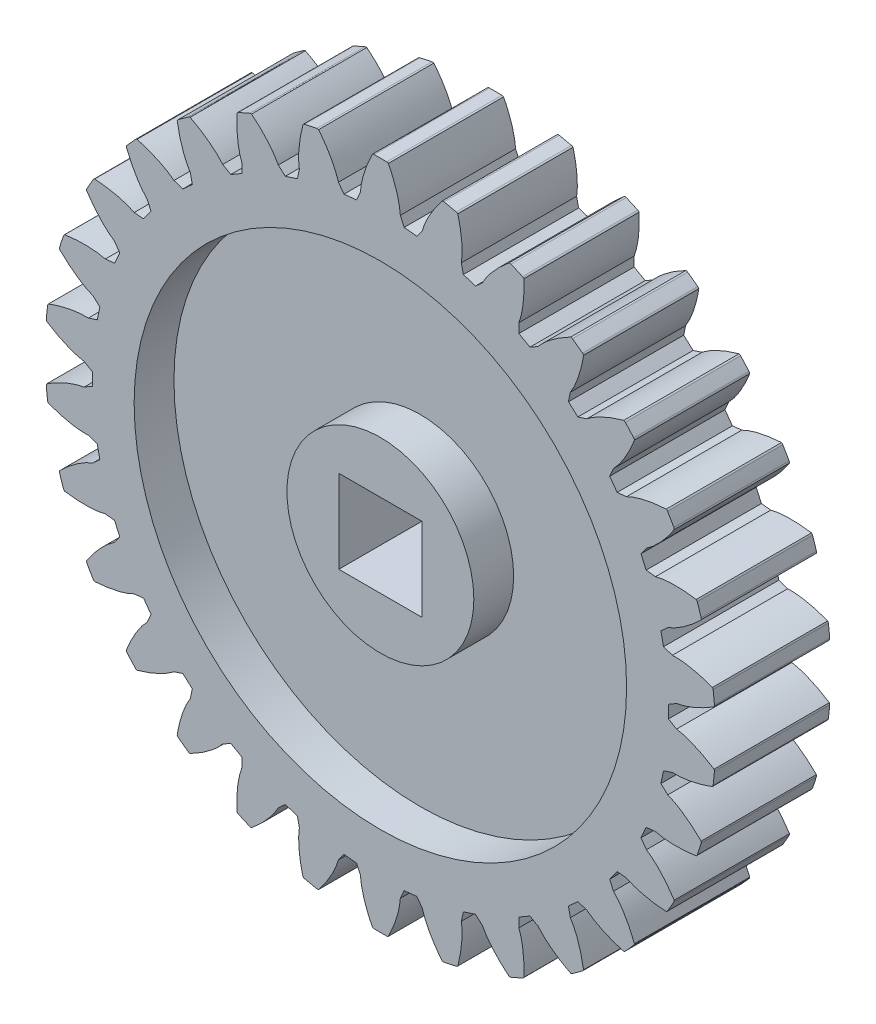
from build123d import *

# Parameters (mm, degrees)
BOSS_EXTRUDE1_DEPTH = 2.75
SKETCH2_R           = 11.75
SKETCH2_R_2         = 4.46
CUT_EXTRUDE1_DEPTH  = 1.9
CUT_EXTRUDE2_START  = -1.9
SKETCH3_R           = 11.75
SKETCH3_R_2         = 4.5
CUT_EXTRUDE2_DEPTH  = 1.9
SKETCH4_R           = 1.945
CUT_EXTRUDE3_DEPTH  = 24.246147151
SKETCH6_W           = 3.96875
SKETCH6_H           = 3.96875
SQUARE_DEPTH        = 24.246147151


with BuildPart() as part:
    # Sketch1 → Boss-Extrude1 (new, symmetric)
    with BuildSketch(Plane.XY):
        with BuildLine():
            ThreePointArc((3.619571149, 15.585207881), (3.326587053, 15.650361612), (3.032432353, 15.710008085))
            add(Edge.make_bspline(
                [(2.94821418, 15.701878254), (2.98689529, 15.7187979), (3.032432353, 15.710008085)],
                knots=[0, 0, 0, 1, 1, 1], degree=2))
            add(Edge.make_bspline(
                [(2.002684585, 14.001333447), (2.021037482, 14.060934408), (2.039390379, 14.120535368), (2.14439226, 14.461528568), (2.613380053, 15.284185561), (2.94821418, 15.701878254)],
                knots=[-0.082147632, -0.082147632, -0.082147632, 0, 0, 0.469988803, 0.946949881, 0.946949881, 0.946949881], degree=2))
            add(Edge.make_bspline(
                [(1.737896443, 13.640815332), (1.799016307, 13.725511736), (1.860136171, 13.81020814), (1.905740786, 13.873404403), (1.953485414, 13.936409203), (1.978085, 13.968871325), (2.002684585, 14.001333447)],
                knots=[-1.340212241, -1.340212241, -1.340212241, 0, 0, 1, 1, 1.515232525, 1.515232525, 1.515232525], degree=2))
            add(Edge.make_bspline(
                [(1.136165743, 13.704059777), (1.221838194, 13.695875955), (1.307510644, 13.687692133), (1.437331013, 13.6752911), (1.566892815, 13.660429968), (1.652394629, 13.65062265), (1.737896443, 13.640815332)],
                knots=[-0.659930726, -0.659930726, -0.659930726, 0, 0, 1, 1, 1.659930726, 1.659930726, 1.659930726], degree=2))
            add(Edge.make_bspline(
                [(0.952119789, 14.111752257), (0.969432559, 14.074884968), (0.98674533, 14.03801768), (1.020347189, 13.966463019), (1.051815993, 13.895166015), (1.093990868, 13.799612896), (1.136165743, 13.704059777)],
                knots=[-0.515232525, -0.515232525, -0.515232525, 0, 0, 1, 1, 2.340212241, 2.340212241, 2.340212241], degree=2))
            add(Edge.make_bspline(
                [(0.380815431, 15.971722736), (0.721366486, 15.295101854), (0.922789827, 14.439409813), (0.940999578, 14.235980893), (0.946559683, 14.173866575), (0.952119789, 14.111752257)],
                knots=[0, 0, 0, 0.627512728, 0.879079195, 0.879079195, 0.955891673, 0.955891673, 0.955891673], degree=2))
            add(Edge.make_bspline(
                [(0.300127913, 15.997184853), (0.346497388, 15.996314902), (0.380815431, 15.971722736)],
                knots=[0, 0, 0, 1, 1, 1], degree=2))
            ThreePointArc((0.300127913, 15.997184853), (0, 16), (-0.300127913, 15.997184853))
            add(Edge.make_bspline(
                [(-0.380815431, 15.971722736), (-0.346497388, 15.996314902), (-0.300127913, 15.997184853)],
                knots=[0, 0, 0, 1, 1, 1], degree=2))
            add(Edge.make_bspline(
                [(-0.952119789, 14.111752257), (-0.946559683, 14.173866575), (-0.940999578, 14.235980893), (-0.909188712, 14.591353692), (-0.621489434, 15.493541701), (-0.380815431, 15.971722736)],
                knots=[-0.082147632, -0.082147632, -0.082147632, 0, 0, 0.469988803, 0.946949881, 0.946949881, 0.946949881], degree=2))
            add(Edge.make_bspline(
                [(-1.136165743, 13.704059777), (-1.093990868, 13.799612896), (-1.051815993, 13.895166015), (-1.020347189, 13.966463019), (-0.98674533, 14.03801768), (-0.969432559, 14.074884968), (-0.952119789, 14.111752257)],
                knots=[-1.340212241, -1.340212241, -1.340212241, 0, 0, 1, 1, 1.515232525, 1.515232525, 1.515232525], degree=2))
            add(Edge.make_bspline(
                [(-1.737896443, 13.640815332), (-1.652394629, 13.65062265), (-1.566892815, 13.660429968), (-1.437331013, 13.6752911), (-1.307510644, 13.687692133), (-1.221838194, 13.695875955), (-1.136165743, 13.704059777)],
                knots=[-0.659930726, -0.659930726, -0.659930726, 0, 0, 1, 1, 1.659930726, 1.659930726, 1.659930726], degree=2))
            add(Edge.make_bspline(
                [(-2.002684585, 14.001333447), (-1.978085, 13.968871325), (-1.953485414, 13.936409203), (-1.905740786, 13.873404403), (-1.860136171, 13.81020814), (-1.799016307, 13.725511736), (-1.737896443, 13.640815332)],
                knots=[-0.515232525, -0.515232525, -0.515232525, 0, 0, 1, 1, 2.340212241, 2.340212241, 2.340212241], degree=2))
            add(Edge.make_bspline(
                [(-2.94821418, 15.701878254), (-2.47442759, 15.110847707), (-2.099497453, 14.315732858), (-2.039390379, 14.120535368), (-2.021037482, 14.060934408), (-2.002684585, 14.001333447)],
                knots=[0, 0, 0, 0.627512728, 0.879079195, 0.879079195, 0.955891673, 0.955891673, 0.955891673], degree=2))
            add(Edge.make_bspline(
                [(-3.032432353, 15.710008085), (-2.98689529, 15.7187979), (-2.94821418, 15.701878254)],
                knots=[0, 0, 0, 1, 1, 1], degree=2))
            ThreePointArc((-3.032432353, 15.710008085), (-3.326587053, 15.650361612), (-3.619571149, 15.585207881))
            add(Edge.make_bspline(
                [(-3.693201579, 15.543526294), (-3.664746466, 15.574716184), (-3.619571149, 15.585207881)],
                knots=[0, 0, 0, 1, 1, 1], degree=2))
            add(Edge.make_bspline(
                [(-3.865311959, 13.605419777), (-3.872787648, 13.667332759), (-3.880263337, 13.729245741), (-3.923033774, 14.083466643), (-3.82919685, 15.025755723), (-3.693201579, 15.543526294)],
                knots=[-0.082147632, -0.082147632, -0.082147632, 0, 0, 0.469988803, 0.946949881, 0.946949881, 0.946949881], degree=2))
            add(Edge.make_bspline(
                [(-3.960572035, 13.168371051), (-3.939185393, 13.270604754), (-3.91779875, 13.372838458), (-3.901841096, 13.449120184), (-3.883850569, 13.526097423), (-3.874581264, 13.5657586), (-3.865311959, 13.605419777)],
                knots=[-1.340212241, -1.340212241, -1.340212241, 0, 0, 1, 1, 1.515232525, 1.515232525, 1.515232525], degree=2))
            add(Edge.make_bspline(
                [(-4.536004216, 12.981401801), (-4.454409878, 13.008771632), (-4.37281554, 13.036141463), (-4.249174777, 13.077615258), (-4.124769614, 13.11673647), (-4.042670825, 13.14255376), (-3.960572035, 13.168371051)],
                knots=[-0.659930726, -0.659930726, -0.659930726, 0, 0, 1, 1, 1.659930726, 1.659930726, 1.659930726], degree=2))
            add(Edge.make_bspline(
                [(-4.869962033, 13.27898918), (-4.839150753, 13.252350975), (-4.808339472, 13.225712769), (-4.748538744, 13.174011441), (-4.690791458, 13.121677902), (-4.613397837, 13.051539851), (-4.536004216, 12.981401801)],
                knots=[-0.515232525, -0.515232525, -0.515232525, 0, 0, 1, 1, 2.340212241, 2.340212241, 2.340212241], degree=2))
            add(Edge.make_bspline(
                [(-6.148392683, 14.745786346), (-5.562077307, 14.266177006), (-5.030026621, 13.566389682), (-4.930649189, 13.387954689), (-4.900305611, 13.333471935), (-4.869962033, 13.27898918)],
                knots=[0, 0, 0, 0.627512728, 0.879079195, 0.879079195, 0.955891673, 0.955891673, 0.955891673], degree=2))
            add(Edge.make_bspline(
                [(-6.232460774, 14.736228578), (-6.18974631, 14.754294002), (-6.148392683, 14.745786346)],
                knots=[0, 0, 0, 1, 1, 1], degree=2))
            ThreePointArc((-6.232460774, 14.736228578), (-6.507786289, 14.616727322), (-6.780821758, 14.492082538))
            add(Edge.make_bspline(
                [(-6.844177097, 14.436003166), (-6.822828539, 14.472427634), (-6.780821758, 14.492082538)],
                knots=[0, 0, 0, 1, 1, 1], degree=2))
            add(Edge.make_bspline(
                [(-6.609571449, 12.504465167), (-6.629756209, 12.563470919), (-6.649940969, 12.62247667), (-6.765423436, 12.960064522), (-6.86954999, 13.901272118), (-6.844177097, 14.436003166)],
                knots=[-0.082147632, -0.082147632, -0.082147632, 0, 0, 0.469988803, 0.946949881, 0.946949881, 0.946949881], degree=2))
            add(Edge.make_bspline(
                [(-6.611882324, 12.05716132), (-6.612218613, 12.161607505), (-6.612554902, 12.26605369), (-6.612805824, 12.34398626), (-6.611212901, 12.423021803), (-6.610392175, 12.463743485), (-6.609571449, 12.504465167)],
                knots=[-1.340212241, -1.340212241, -1.340212241, 0, 0, 1, 1, 1.515232525, 1.515232525, 1.515232525], degree=2))
            add(Edge.make_bspline(
                [(-7.135866839, 11.75463872), (-7.06174604, 11.798374871), (-6.987625242, 11.842111023), (-6.875309213, 11.908384875), (-6.761756359, 11.972516483), (-6.686819342, 12.014838902), (-6.611882324, 12.05716132)],
                knots=[-0.659930726, -0.659930726, -0.659930726, 0, 0, 1, 1, 1.659930726, 1.659930726, 1.659930726], degree=2))
            add(Edge.make_bspline(
                [(-7.524398771, 11.976289366), (-7.488722397, 11.956639295), (-7.453046023, 11.936989223), (-7.383802773, 11.898850964), (-7.316436649, 11.859667374), (-7.226151744, 11.807153047), (-7.135866839, 11.75463872)],
                knots=[-0.515232525, -0.515232525, -0.515232525, 0, 0, 1, 1, 2.340212241, 2.340212241, 2.340212241], degree=2))
            add(Edge.make_bspline(
                [(-9.079856923, 13.145232817), (-8.406637555, 12.798005913), (-7.740719488, 12.224130179), (-7.606414971, 12.070256148), (-7.565406871, 12.023272757), (-7.524398771, 11.976289366)],
                knots=[0, 0, 0, 0.627512728, 0.879079195, 0.879079195, 0.955891673, 0.955891673, 0.955891673], degree=2))
            add(Edge.make_bspline(
                [(-9.160100753, 13.11840517), (-9.122075715, 13.144956657), (-9.079856923, 13.145232817)],
                knots=[0, 0, 0, 1, 1, 1], degree=2))
            ThreePointArc((-9.160100753, 13.11840517), (-9.404564037, 12.94427191), (-9.645717917, 12.765583647))
            add(Edge.make_bspline(
                [(-9.696029233, 12.697557429), (-9.682720265, 12.737624549), (-9.645717917, 12.765583647)],
                knots=[0, 0, 0, 1, 1, 1], degree=2))
            add(Edge.make_bspline(
                [(-9.06496095, 10.857005426), (-9.096972611, 10.910525113), (-9.128984271, 10.9640448), (-9.31213163, 11.270245392), (-9.609670831, 12.169236216), (-9.696029233, 12.697557429)],
                knots=[-0.082147632, -0.082147632, -0.082147632, 0, 0, 0.469988803, 0.946949881, 0.946949881, 0.946949881], degree=2))
            add(Edge.make_bspline(
                [(-8.974221628, 10.418995784), (-8.996266151, 10.52108965), (-9.018310674, 10.623183517), (-9.034759206, 10.699360904), (-9.049633505, 10.777000518), (-9.057297228, 10.817002972), (-9.06496095, 10.857005426)],
                knots=[-1.340212241, -1.340212241, -1.340212241, 0, 0, 1, 1, 1.515232525, 1.515232525, 1.515232525], degree=2))
            add(Edge.make_bspline(
                [(-9.423857839, 10.014141521), (-9.360450015, 10.072332514), (-9.297042191, 10.130523506), (-9.200959646, 10.218700931), (-9.103221905, 10.305040075), (-9.038721767, 10.362017929), (-8.974221628, 10.418995784)],
                knots=[-0.659930726, -0.659930726, -0.659930726, 0, 0, 1, 1, 1.659930726, 1.659930726, 1.659930726], degree=2))
            add(Edge.make_bspline(
                [(-9.849983177, 10.150168239), (-9.811000937, 10.138365103), (-9.772018698, 10.126561968), (-9.69635919, 10.103653603), (-9.62231845, 10.079332473), (-9.523088144, 10.046736997), (-9.423857839, 10.014141521)],
                knots=[-0.515232525, -0.515232525, -0.515232525, 0, 0, 1, 1, 2.340212241, 2.340212241, 2.340212241], degree=2))
            add(Edge.make_bspline(
                [(-11.614487845, 10.970169536), (-10.883787403, 10.770500549), (-10.113105769, 10.347617528), (-9.949743918, 10.225029494), (-9.899863547, 10.187598866), (-9.849983177, 10.150168239)],
                knots=[0, 0, 0, 0.627512728, 0.879079195, 0.879079195, 0.955891673, 0.955891673, 0.955891673], degree=2))
            add(Edge.make_bspline(
                [(-11.687400373, 10.927244507), (-11.655726639, 10.961121631), (-11.614487845, 10.970169536)],
                knots=[0, 0, 0, 1, 1, 1], degree=2))
            ThreePointArc((-11.687400373, 10.927244507), (-11.890317208, 10.706089702), (-12.089049919, 10.481167495))
            add(Edge.make_bspline(
                [(-12.124118365, 10.404167502), (-12.119430653, 10.446126149), (-12.089049919, 10.481167495)],
                knots=[0, 0, 0, 1, 1, 1], degree=2))
            add(Edge.make_bspline(
                [(-11.12416816, 8.73504245), (-11.166607657, 8.780737005), (-11.209047154, 8.82643156), (-11.451854987, 9.087862457), (-11.929802945, 9.905346296), (-12.124118365, 10.404167502)],
                knots=[-0.082147632, -0.082147632, -0.082147632, 0, 0, 0.469988803, 0.946949881, 0.946949881, 0.946949881], degree=2))
            add(Edge.make_bspline(
                [(-10.944344384, 8.325470135), (-10.98713369, 8.420749692), (-11.029922996, 8.516029249), (-11.061850257, 8.587122135), (-11.0925417, 8.659972596), (-11.10835493, 8.697507523), (-11.12416816, 8.73504245)],
                knots=[-1.340212241, -1.340212241, -1.340212241, 0, 0, 1, 1, 1.515232525, 1.515232525, 1.515232525], degree=2))
            add(Edge.make_bspline(
                [(-11.29998103, 7.835978285), (-11.250057407, 7.906080893), (-11.200133784, 7.9761835), (-11.12448399, 8.082410721), (-11.046832971, 8.187183967), (-10.995588678, 8.256327051), (-10.944344384, 8.325470135)],
                knots=[-0.659930726, -0.659930726, -0.659930726, 0, 0, 1, 1, 1.659930726, 1.659930726, 1.659930726], degree=2))
            add(Edge.make_bspline(
                [(-11.745076052, 7.880436053), (-11.704491658, 7.876995708), (-11.663907265, 7.873555363), (-11.585138181, 7.866878096), (-11.507658762, 7.858482377), (-11.403819896, 7.847230331), (-11.29998103, 7.835978285)],
                knots=[-0.515232525, -0.515232525, -0.515232525, 0, 0, 1, 1, 2.340212241, 2.340212241, 2.340212241], degree=2))
            add(Edge.make_bspline(
                [(-13.641509916, 8.315657205), (-12.885263516, 8.27227263), (-12.0435008, 8.018864339), (-11.858221312, 7.932919986), (-11.801648682, 7.906678019), (-11.745076052, 7.880436053)],
                knots=[0, 0, 0, 0.627512728, 0.879079195, 0.879079195, 0.955891673, 0.955891673, 0.955891673], degree=2))
            add(Edge.make_bspline(
                [(-13.703904515, 8.258510824), (-13.679966378, 8.298232991), (-13.641509916, 8.315657205)],
                knots=[0, 0, 0, 1, 1, 1], degree=2))
            ThreePointArc((-13.703904515, 8.258510824), (-13.856406461, 8), (-14.004032429, 7.738674029))
            add(Edge.make_bspline(
                [(-14.022325347, 7.656065531), (-14.026463766, 7.698081911), (-14.004032429, 7.738674029)],
                knots=[0, 0, 0, 1, 1, 1], degree=2))
            add(Edge.make_bspline(
                [(-12.697195841, 6.231316204), (-12.748208365, 6.267188556), (-12.79922089, 6.303060907), (-13.091077329, 6.508296325), (-13.728545425, 7.208545213), (-14.022325347, 7.656065531)],
                knots=[-0.082147632, -0.082147632, -0.082147632, 0, 0, 0.469988803, 0.946949881, 0.946949881, 0.946949881], degree=2))
            add(Edge.make_bspline(
                [(-12.436146774, 5.868081492), (-12.497810764, 5.952382565), (-12.559474755, 6.036683638), (-12.60548537, 6.099584923), (-12.650652595, 6.164462317), (-12.673924218, 6.197889261), (-12.697195841, 6.231316204)],
                knots=[-1.340212241, -1.340212241, -1.340212241, 0, 0, 1, 1, 1.515232525, 1.515232525, 1.515232525], degree=2))
            add(Edge.make_bspline(
                [(-12.682240828, 5.315345197), (-12.647983307, 5.394295599), (-12.613725786, 5.473246001), (-12.561815003, 5.592880379), (-12.507644428, 5.711508633), (-12.471895601, 5.789795062), (-12.436146774, 5.868081492)],
                knots=[-0.659930726, -0.659930726, -0.659930726, 0, 0, 1, 1, 1.659930726, 1.659930726, 1.659930726], degree=2))
            add(Edge.make_bspline(
                [(-13.126852745, 5.266290997), (-13.08643993, 5.271363802), (-13.046027114, 5.276436607), (-12.967591043, 5.286282268), (-12.890059167, 5.294178892), (-12.786149997, 5.304762044), (-12.682240828, 5.315345197)],
                knots=[-0.515232525, -0.515232525, -0.515232525, 0, 0, 1, 1, 2.340212241, 2.340212241, 2.340212241], degree=2))
            add(Edge.make_bspline(
                [(-15.072332545, 5.297710752), (-14.323591782, 5.412506701), (-13.447537055, 5.339648299), (-13.248437533, 5.294103808), (-13.187645139, 5.280197402), (-13.126852745, 5.266290997)],
                knots=[0, 0, 0, 0.627512728, 0.879079195, 0.879079195, 0.955891673, 0.955891673, 0.955891673], degree=2))
            add(Edge.make_bspline(
                [(-15.121482272, 5.22884059), (-15.106325943, 5.27267175), (-15.072332545, 5.297710752)],
                knots=[0, 0, 0, 1, 1, 1], degree=2))
            ThreePointArc((-15.121482272, 5.22884059), (-15.216904261, 4.94427191), (-15.306971523, 4.657963374))
            add(Edge.make_bspline(
                [(-15.307689424, 4.573356758), (-15.320473106, 4.613594554), (-15.306971523, 4.657963374)],
                knots=[0, 0, 0, 1, 1, 1], degree=2))
            add(Edge.make_bspline(
                [(-13.715295136, 3.455251538), (-13.772651195, 3.479733893), (-13.830007255, 3.504216247), (-14.158156773, 3.644286413), (-14.927284592, 4.196696113), (-15.307689424, 4.573356758)],
                knots=[-0.082147632, -0.082147632, -0.082147632, 0, 0, 0.469988803, 0.946949881, 0.946949881, 0.946949881], degree=2))
            add(Edge.make_bspline(
                [(-13.384429874, 3.154229529), (-13.462273537, 3.223867757), (-13.5401172, 3.293505985), (-13.598200286, 3.345466581), (-13.655869267, 3.399535454), (-13.685582201, 3.427393496), (-13.715295136, 3.455251538)],
                knots=[-1.340212241, -1.340212241, -1.340212241, 0, 0, 1, 1, 1.515232525, 1.515232525, 1.515232525], degree=2))
            add(Edge.make_bspline(
                [(-13.510225845, 2.562406018), (-13.493131645, 2.646753703), (-13.476037445, 2.731101388), (-13.450134423, 2.858914327), (-13.421811805, 2.986212965), (-13.40312084, 3.070221247), (-13.384429874, 3.154229529)],
                knots=[-0.659930726, -0.659930726, -0.659930726, 0, 0, 1, 1, 1.659930726, 1.659930726, 1.659930726], degree=2))
            add(Edge.make_bspline(
                [(-13.934922983, 2.421983754), (-13.89644798, 2.435348003), (-13.857972977, 2.448712251), (-13.78329795, 2.474650537), (-13.709102132, 2.498494385), (-13.609663988, 2.530450201), (-13.510225845, 2.562406018)],
                knots=[-0.515232525, -0.515232525, -0.515232525, 0, 0, 1, 1, 2.340212241, 2.340212241, 2.340212241], degree=2))
            add(Edge.make_bspline(
                [(-15.844421916, 2.048228917), (-15.135910355, 2.316188258), (-14.263851413, 2.427064006), (-14.05963346, 2.423909889), (-13.997278222, 2.422946822), (-13.934922983, 2.421983754)],
                knots=[0, 0, 0, 0.627512728, 0.879079195, 0.879079195, 0.955891673, 0.955891673, 0.955891673], degree=2))
            add(Edge.make_bspline(
                [(-15.878178691, 1.97064493), (-15.872466576, 2.016669453), (-15.844421916, 2.048228917)],
                knots=[0, 0, 0, 1, 1, 1], degree=2))
            ThreePointArc((-15.878178691, 1.97064493), (-15.912350326, 1.672455412), (-15.940922511, 1.373677368))
            add(Edge.make_bspline(
                [(-15.924034019, 1.29077035), (-15.944904255, 1.327470976), (-15.940922511, 1.373677368)],
                knots=[0, 0, 0, 1, 1, 1], degree=2))
            add(Edge.make_bspline(
                [(-14.13397022, 0.528175801), (-14.19516308, 0.540198161), (-14.25635594, 0.552220522), (-14.606456829, 0.621003698), (-15.473629794, 1.001431255), (-15.924034019, 1.29077035)],
                knots=[-0.082147632, -0.082147632, -0.082147632, 0, 0, 0.469988803, 0.946949881, 0.946949881, 0.946949881], degree=2))
            add(Edge.make_bspline(
                [(-13.747749163, 0.302522601), (-13.838370357, 0.354454458), (-13.928991551, 0.406386316), (-13.996608597, 0.445135296), (-14.064258923, 0.486032579), (-14.099114572, 0.50710419), (-14.13397022, 0.528175801)],
                knots=[-1.340212241, -1.340212241, -1.340212241, 0, 0, 1, 1, 1.515232525, 1.515232525, 1.515232525], degree=2))
            add(Edge.make_bspline(
                [(-13.747749163, -0.302522601), (-13.748565382, -0.21646403), (-13.749381601, -0.13040546), (-13.750618427, 0), (-13.749381601, 0.13040546), (-13.748565382, 0.21646403), (-13.747749163, 0.302522601)],
                knots=[-0.659930726, -0.659930726, -0.659930726, 0, 0, 1, 1, 1.659930726, 1.659930726, 1.659930726], degree=2))
            add(Edge.make_bspline(
                [(-14.13397022, -0.528175801), (-14.099114572, -0.50710419), (-14.064258923, -0.486032579), (-13.996608597, -0.445135296), (-13.928991551, -0.406386316), (-13.838370357, -0.354454458), (-13.747749163, -0.302522601)],
                knots=[-0.515232525, -0.515232525, -0.515232525, 0, 0, 1, 1, 2.340212241, 2.340212241, 2.340212241], degree=2))
            add(Edge.make_bspline(
                [(-15.924034019, -1.29077035), (-15.286717016, -0.881358727), (-14.456767018, -0.591594631), (-14.25635594, -0.552220522), (-14.19516308, -0.540198161), (-14.13397022, -0.528175801)],
                knots=[0, 0, 0, 0.627512728, 0.879079195, 0.879079195, 0.955891673, 0.955891673, 0.955891673], degree=2))
            add(Edge.make_bspline(
                [(-15.940922511, -1.373677368), (-15.944904255, -1.327470976), (-15.924034019, -1.29077035)],
                knots=[0, 0, 0, 1, 1, 1], degree=2))
            ThreePointArc((-15.940922511, -1.373677368), (-15.912350326, -1.672455412), (-15.878178691, -1.97064493))
            add(Edge.make_bspline(
                [(-15.844421916, -2.048228917), (-15.872466576, -2.016669453), (-15.878178691, -1.97064493)],
                knots=[0, 0, 0, 1, 1, 1], degree=2))
            add(Edge.make_bspline(
                [(-13.934922983, -2.421983754), (-13.997278222, -2.422946822), (-14.05963346, -2.423909889), (-14.416384631, -2.429419859), (-15.343703123, -2.237600954), (-15.844421916, -2.048228917)],
                knots=[-0.082147632, -0.082147632, -0.082147632, 0, 0, 0.469988803, 0.946949881, 0.946949881, 0.946949881], degree=2))
            add(Edge.make_bspline(
                [(-13.510225845, -2.562406018), (-13.609663988, -2.530450201), (-13.709102132, -2.498494385), (-13.78329795, -2.474650537), (-13.857972977, -2.448712251), (-13.89644798, -2.435348003), (-13.934922983, -2.421983754)],
                knots=[-1.340212241, -1.340212241, -1.340212241, 0, 0, 1, 1, 1.515232525, 1.515232525, 1.515232525], degree=2))
            add(Edge.make_bspline(
                [(-13.384429874, -3.154229529), (-13.40312084, -3.070221247), (-13.421811805, -2.986212965), (-13.450134423, -2.858914327), (-13.476037445, -2.731101388), (-13.493131645, -2.646753703), (-13.510225845, -2.562406018)],
                knots=[-0.659930726, -0.659930726, -0.659930726, 0, 0, 1, 1, 1.659930726, 1.659930726, 1.659930726], degree=2))
            add(Edge.make_bspline(
                [(-13.715295136, -3.455251538), (-13.685582201, -3.427393496), (-13.655869267, -3.399535454), (-13.598200286, -3.345466581), (-13.5401172, -3.293505985), (-13.462273537, -3.223867757), (-13.384429874, -3.154229529)],
                knots=[-0.515232525, -0.515232525, -0.515232525, 0, 0, 1, 1, 2.340212241, 2.340212241, 2.340212241], degree=2))
            add(Edge.make_bspline(
                [(-15.307689424, -4.573356758), (-14.769420789, -4.040386106), (-14.017852533, -3.584397743), (-13.830007255, -3.504216247), (-13.772651195, -3.479733893), (-13.715295136, -3.455251538)],
                knots=[0, 0, 0, 0.627512728, 0.879079195, 0.879079195, 0.955891673, 0.955891673, 0.955891673], degree=2))
            add(Edge.make_bspline(
                [(-15.306971523, -4.657963374), (-15.320473106, -4.613594554), (-15.307689424, -4.573356758)],
                knots=[0, 0, 0, 1, 1, 1], degree=2))
            ThreePointArc((-15.306971523, -4.657963374), (-15.216904261, -4.94427191), (-15.121482272, -5.22884059))
            add(Edge.make_bspline(
                [(-15.072332545, -5.297710752), (-15.106325943, -5.27267175), (-15.121482272, -5.22884059)],
                knots=[0, 0, 0, 1, 1, 1], degree=2))
            add(Edge.make_bspline(
                [(-13.126852745, -5.266290997), (-13.187645139, -5.280197402), (-13.248437533, -5.294103808), (-13.596247247, -5.373666111), (-14.543182998, -5.378839264), (-15.072332545, -5.297710752)],
                knots=[-0.082147632, -0.082147632, -0.082147632, 0, 0, 0.469988803, 0.946949881, 0.946949881, 0.946949881], degree=2))
            add(Edge.make_bspline(
                [(-12.682240828, -5.315345197), (-12.786149997, -5.304762044), (-12.890059167, -5.294178892), (-12.967591043, -5.286282268), (-13.046027114, -5.276436607), (-13.08643993, -5.271363802), (-13.126852745, -5.266290997)],
                knots=[-1.340212241, -1.340212241, -1.340212241, 0, 0, 1, 1, 1.515232525, 1.515232525, 1.515232525], degree=2))
            add(Edge.make_bspline(
                [(-12.436146774, -5.868081492), (-12.471895601, -5.789795062), (-12.507644428, -5.711508633), (-12.561815003, -5.592880379), (-12.613725786, -5.473246001), (-12.647983307, -5.394295599), (-12.682240828, -5.315345197)],
                knots=[-0.659930726, -0.659930726, -0.659930726, 0, 0, 1, 1, 1.659930726, 1.659930726, 1.659930726], degree=2))
            add(Edge.make_bspline(
                [(-12.697195841, -6.231316204), (-12.673924218, -6.197889261), (-12.650652595, -6.164462317), (-12.60548537, -6.099584923), (-12.559474755, -6.036683638), (-12.497810764, -5.952382565), (-12.436146774, -5.868081492)],
                knots=[-0.515232525, -0.515232525, -0.515232525, 0, 0, 1, 1, 2.340212241, 2.340212241, 2.340212241], degree=2))
            add(Edge.make_bspline(
                [(-14.022325347, -7.656065531), (-13.606630002, -7.022829224), (-12.966290627, -6.420545474), (-12.79922089, -6.303060907), (-12.748208365, -6.267188556), (-12.697195841, -6.231316204)],
                knots=[0, 0, 0, 0.627512728, 0.879079195, 0.879079195, 0.955891673, 0.955891673, 0.955891673], degree=2))
            add(Edge.make_bspline(
                [(-14.004032429, -7.738674029), (-14.026463766, -7.698081911), (-14.022325347, -7.656065531)],
                knots=[0, 0, 0, 1, 1, 1], degree=2))
            ThreePointArc((-14.004032429, -7.738674029), (-13.856406461, -8), (-13.703904515, -8.258510824))
            add(Edge.make_bspline(
                [(-13.641509916, -8.315657205), (-13.679966378, -8.298232991), (-13.703904515, -8.258510824)],
                knots=[0, 0, 0, 1, 1, 1], degree=2))
            add(Edge.make_bspline(
                [(-11.745076052, -7.880436053), (-11.801648682, -7.906678019), (-11.858221312, -7.932919986), (-12.181888617, -8.083057367), (-13.107055991, -8.284996488), (-13.641509916, -8.315657205)],
                knots=[-0.082147632, -0.082147632, -0.082147632, 0, 0, 0.469988803, 0.946949881, 0.946949881, 0.946949881], degree=2))
            add(Edge.make_bspline(
                [(-11.29998103, -7.835978285), (-11.403819896, -7.847230331), (-11.507658762, -7.858482377), (-11.585138181, -7.866878096), (-11.663907265, -7.873555363), (-11.704491658, -7.876995708), (-11.745076052, -7.880436053)],
                knots=[-1.340212241, -1.340212241, -1.340212241, 0, 0, 1, 1, 1.515232525, 1.515232525, 1.515232525], degree=2))
            add(Edge.make_bspline(
                [(-10.944344384, -8.325470135), (-10.995588678, -8.256327051), (-11.046832971, -8.187183967), (-11.12448399, -8.082410721), (-11.200133784, -7.9761835), (-11.250057407, -7.906080893), (-11.29998103, -7.835978285)],
                knots=[-0.659930726, -0.659930726, -0.659930726, 0, 0, 1, 1, 1.659930726, 1.659930726, 1.659930726], degree=2))
            add(Edge.make_bspline(
                [(-11.12416816, -8.73504245), (-11.10835493, -8.697507523), (-11.0925417, -8.659972596), (-11.061850257, -8.587122135), (-11.029922996, -8.516029249), (-10.98713369, -8.420749692), (-10.944344384, -8.325470135)],
                knots=[-0.515232525, -0.515232525, -0.515232525, 0, 0, 1, 1, 2.340212241, 2.340212241, 2.340212241], degree=2))
            add(Edge.make_bspline(
                [(-12.124118365, -10.404167502), (-11.849164192, -9.698341006), (-11.348039602, -8.976084559), (-11.209047154, -8.82643156), (-11.166607657, -8.780737005), (-11.12416816, -8.73504245)],
                knots=[0, 0, 0, 0.627512728, 0.879079195, 0.879079195, 0.955891673, 0.955891673, 0.955891673], degree=2))
            add(Edge.make_bspline(
                [(-12.089049919, -10.481167495), (-12.119430653, -10.446126149), (-12.124118365, -10.404167502)],
                knots=[0, 0, 0, 1, 1, 1], degree=2))
            ThreePointArc((-12.089049919, -10.481167495), (-11.890317208, -10.706089702), (-11.687400373, -10.927244507))
            add(Edge.make_bspline(
                [(-11.614487845, -10.970169536), (-11.655726639, -10.961121631), (-11.687400373, -10.927244507)],
                knots=[0, 0, 0, 1, 1, 1], degree=2))
            add(Edge.make_bspline(
                [(-9.849983177, -10.150168239), (-9.899863547, -10.187598866), (-9.949743918, -10.225029494), (-10.235122999, -10.43918023), (-11.098087742, -10.82905961), (-11.614487845, -10.970169536)],
                knots=[-0.082147632, -0.082147632, -0.082147632, 0, 0, 0.469988803, 0.946949881, 0.946949881, 0.946949881], degree=2))
            add(Edge.make_bspline(
                [(-9.423857839, -10.014141521), (-9.523088144, -10.046736997), (-9.62231845, -10.079332473), (-9.69635919, -10.103653603), (-9.772018698, -10.126561968), (-9.811000937, -10.138365103), (-9.849983177, -10.150168239)],
                knots=[-1.340212241, -1.340212241, -1.340212241, 0, 0, 1, 1, 1.515232525, 1.515232525, 1.515232525], degree=2))
            add(Edge.make_bspline(
                [(-8.974221628, -10.418995784), (-9.038721767, -10.362017929), (-9.103221905, -10.305040075), (-9.200959646, -10.218700931), (-9.297042191, -10.130523506), (-9.360450015, -10.072332514), (-9.423857839, -10.014141521)],
                knots=[-0.659930726, -0.659930726, -0.659930726, 0, 0, 1, 1, 1.659930726, 1.659930726, 1.659930726], degree=2))
            add(Edge.make_bspline(
                [(-9.06496095, -10.857005426), (-9.057297228, -10.817002972), (-9.049633505, -10.777000518), (-9.034759206, -10.699360904), (-9.018310674, -10.623183517), (-8.996266151, -10.52108965), (-8.974221628, -10.418995784)],
                knots=[-0.515232525, -0.515232525, -0.515232525, 0, 0, 1, 1, 2.340212241, 2.340212241, 2.340212241], degree=2))
            add(Edge.make_bspline(
                [(-9.696029233, -12.697557429), (-9.573833049, -11.949988748), (-9.233824792, -11.139325676), (-9.128984271, -10.9640448), (-9.096972611, -10.910525113), (-9.06496095, -10.857005426)],
                knots=[0, 0, 0, 0.627512728, 0.879079195, 0.879079195, 0.955891673, 0.955891673, 0.955891673], degree=2))
            add(Edge.make_bspline(
                [(-9.645717917, -12.765583647), (-9.682720265, -12.737624549), (-9.696029233, -12.697557429)],
                knots=[0, 0, 0, 1, 1, 1], degree=2))
            ThreePointArc((-9.645717917, -12.765583647), (-9.404564037, -12.94427191), (-9.160100753, -13.11840517))
            add(Edge.make_bspline(
                [(-9.079856923, -13.145232817), (-9.122075715, -13.144956657), (-9.160100753, -13.11840517)],
                knots=[0, 0, 0, 1, 1, 1], degree=2))
            add(Edge.make_bspline(
                [(-7.524398771, -11.976289366), (-7.565406871, -12.023272757), (-7.606414971, -12.070256148), (-7.841033392, -12.339060824), (-8.604079804, -12.899840863), (-9.079856923, -13.145232817)],
                knots=[-0.082147632, -0.082147632, -0.082147632, 0, 0, 0.469988803, 0.946949881, 0.946949881, 0.946949881], degree=2))
            add(Edge.make_bspline(
                [(-7.135866839, -11.75463872), (-7.226151744, -11.807153047), (-7.316436649, -11.859667374), (-7.383802773, -11.898850964), (-7.453046023, -11.936989223), (-7.488722397, -11.956639295), (-7.524398771, -11.976289366)],
                knots=[-1.340212241, -1.340212241, -1.340212241, 0, 0, 1, 1, 1.515232525, 1.515232525, 1.515232525], degree=2))
            add(Edge.make_bspline(
                [(-6.611882324, -12.05716132), (-6.686819342, -12.014838902), (-6.761756359, -11.972516483), (-6.875309213, -11.908384875), (-6.987625242, -11.842111023), (-7.06174604, -11.798374871), (-7.135866839, -11.75463872)],
                knots=[-0.659930726, -0.659930726, -0.659930726, 0, 0, 1, 1, 1.659930726, 1.659930726, 1.659930726], degree=2))
            add(Edge.make_bspline(
                [(-6.609571449, -12.504465167), (-6.610392175, -12.463743485), (-6.611212901, -12.423021803), (-6.612805824, -12.34398626), (-6.612554902, -12.26605369), (-6.612218613, -12.161607505), (-6.611882324, -12.05716132)],
                knots=[-0.515232525, -0.515232525, -0.515232525, 0, 0, 1, 1, 2.340212241, 2.340212241, 2.340212241], degree=2))
            add(Edge.make_bspline(
                [(-6.844177097, -14.436003166), (-6.88007946, -13.67936464), (-6.71604753, -12.815724809), (-6.649940969, -12.62247667), (-6.629756209, -12.563470919), (-6.609571449, -12.504465167)],
                knots=[0, 0, 0, 0.627512728, 0.879079195, 0.879079195, 0.955891673, 0.955891673, 0.955891673], degree=2))
            add(Edge.make_bspline(
                [(-6.780821758, -14.492082538), (-6.822828539, -14.472427634), (-6.844177097, -14.436003166)],
                knots=[0, 0, 0, 1, 1, 1], degree=2))
            ThreePointArc((-6.780821758, -14.492082538), (-6.507786289, -14.616727322), (-6.232460774, -14.736228578))
            add(Edge.make_bspline(
                [(-6.148392683, -14.745786346), (-6.18974631, -14.754294002), (-6.232460774, -14.736228578)],
                knots=[0, 0, 0, 1, 1, 1], degree=2))
            add(Edge.make_bspline(
                [(-4.869962033, -13.27898918), (-4.900305611, -13.333471935), (-4.930649189, -13.387954689), (-5.104253001, -13.699665251), (-5.734032292, -14.40683717), (-6.148392683, -14.745786346)],
                knots=[-0.082147632, -0.082147632, -0.082147632, 0, 0, 0.469988803, 0.946949881, 0.946949881, 0.946949881], degree=2))
            add(Edge.make_bspline(
                [(-4.536004216, -12.981401801), (-4.613397837, -13.051539851), (-4.690791458, -13.121677902), (-4.748538744, -13.174011441), (-4.808339472, -13.225712769), (-4.839150753, -13.252350975), (-4.869962033, -13.27898918)],
                knots=[-1.340212241, -1.340212241, -1.340212241, 0, 0, 1, 1, 1.515232525, 1.515232525, 1.515232525], degree=2))
            add(Edge.make_bspline(
                [(-3.960572035, -13.168371051), (-4.042670825, -13.14255376), (-4.124769614, -13.11673647), (-4.249174777, -13.077615258), (-4.37281554, -13.036141463), (-4.454409878, -13.008771632), (-4.536004216, -12.981401801)],
                knots=[-0.659930726, -0.659930726, -0.659930726, 0, 0, 1, 1, 1.659930726, 1.659930726, 1.659930726], degree=2))
            add(Edge.make_bspline(
                [(-3.865311959, -13.605419777), (-3.874581264, -13.5657586), (-3.883850569, -13.526097423), (-3.901841096, -13.449120184), (-3.91779875, -13.372838458), (-3.939185393, -13.270604754), (-3.960572035, -13.168371051)],
                knots=[-0.515232525, -0.515232525, -0.515232525, 0, 0, 1, 1, 2.340212241, 2.340212241, 2.340212241], degree=2))
            add(Edge.make_bspline(
                [(-3.693201579, -15.543526294), (-3.885633386, -14.810886655), (-3.904746764, -13.932015271), (-3.880263337, -13.729245741), (-3.872787648, -13.667332759), (-3.865311959, -13.605419777)],
                knots=[0, 0, 0, 0.627512728, 0.879079195, 0.879079195, 0.955891673, 0.955891673, 0.955891673], degree=2))
            add(Edge.make_bspline(
                [(-3.619571149, -15.585207881), (-3.664746466, -15.574716184), (-3.693201579, -15.543526294)],
                knots=[0, 0, 0, 1, 1, 1], degree=2))
            ThreePointArc((-3.619571149, -15.585207881), (-3.326587053, -15.650361612), (-3.032432353, -15.710008085))
            add(Edge.make_bspline(
                [(-2.94821418, -15.701878254), (-2.98689529, -15.7187979), (-3.032432353, -15.710008085)],
                knots=[0, 0, 0, 1, 1, 1], degree=2))
            add(Edge.make_bspline(
                [(-2.002684585, -14.001333447), (-2.021037482, -14.060934408), (-2.039390379, -14.120535368), (-2.14439226, -14.461528568), (-2.613380053, -15.284185561), (-2.94821418, -15.701878254)],
                knots=[-0.082147632, -0.082147632, -0.082147632, 0, 0, 0.469988803, 0.946949881, 0.946949881, 0.946949881], degree=2))
            add(Edge.make_bspline(
                [(-1.737896443, -13.640815332), (-1.799016307, -13.725511736), (-1.860136171, -13.81020814), (-1.905740786, -13.873404403), (-1.953485414, -13.936409203), (-1.978085, -13.968871325), (-2.002684585, -14.001333447)],
                knots=[-1.340212241, -1.340212241, -1.340212241, 0, 0, 1, 1, 1.515232525, 1.515232525, 1.515232525], degree=2))
            add(Edge.make_bspline(
                [(-1.136165743, -13.704059777), (-1.221838194, -13.695875955), (-1.307510644, -13.687692133), (-1.437331013, -13.6752911), (-1.566892815, -13.660429968), (-1.652394629, -13.65062265), (-1.737896443, -13.640815332)],
                knots=[-0.659930726, -0.659930726, -0.659930726, 0, 0, 1, 1, 1.659930726, 1.659930726, 1.659930726], degree=2))
            add(Edge.make_bspline(
                [(-0.952119789, -14.111752257), (-0.969432559, -14.074884968), (-0.98674533, -14.03801768), (-1.020347189, -13.966463019), (-1.051815993, -13.895166015), (-1.093990868, -13.799612896), (-1.136165743, -13.704059777)],
                knots=[-0.515232525, -0.515232525, -0.515232525, 0, 0, 1, 1, 2.340212241, 2.340212241, 2.340212241], degree=2))
            add(Edge.make_bspline(
                [(-0.380815431, -15.971722736), (-0.721366486, -15.295101854), (-0.922789827, -14.439409813), (-0.940999578, -14.235980893), (-0.946559683, -14.173866575), (-0.952119789, -14.111752257)],
                knots=[0, 0, 0, 0.627512728, 0.879079195, 0.879079195, 0.955891673, 0.955891673, 0.955891673], degree=2))
            add(Edge.make_bspline(
                [(-0.300127913, -15.997184853), (-0.346497388, -15.996314902), (-0.380815431, -15.971722736)],
                knots=[0, 0, 0, 1, 1, 1], degree=2))
            ThreePointArc((-0.300127913, -15.997184853), (0, -16), (0.300127913, -15.997184853))
            add(Edge.make_bspline(
                [(0.380815431, -15.971722736), (0.346497388, -15.996314902), (0.300127913, -15.997184853)],
                knots=[0, 0, 0, 1, 1, 1], degree=2))
            add(Edge.make_bspline(
                [(0.952119789, -14.111752257), (0.946559683, -14.173866575), (0.940999578, -14.235980893), (0.909188712, -14.591353692), (0.621489434, -15.493541701), (0.380815431, -15.971722736)],
                knots=[-0.082147632, -0.082147632, -0.082147632, 0, 0, 0.469988803, 0.946949881, 0.946949881, 0.946949881], degree=2))
            add(Edge.make_bspline(
                [(1.136165743, -13.704059777), (1.093990868, -13.799612896), (1.051815993, -13.895166015), (1.020347189, -13.966463019), (0.98674533, -14.03801768), (0.969432559, -14.074884968), (0.952119789, -14.111752257)],
                knots=[-1.340212241, -1.340212241, -1.340212241, 0, 0, 1, 1, 1.515232525, 1.515232525, 1.515232525], degree=2))
            add(Edge.make_bspline(
                [(1.737896443, -13.640815332), (1.652394629, -13.65062265), (1.566892815, -13.660429968), (1.437331013, -13.6752911), (1.307510644, -13.687692133), (1.221838194, -13.695875955), (1.136165743, -13.704059777)],
                knots=[-0.659930726, -0.659930726, -0.659930726, 0, 0, 1, 1, 1.659930726, 1.659930726, 1.659930726], degree=2))
            add(Edge.make_bspline(
                [(2.002684585, -14.001333447), (1.978085, -13.968871325), (1.953485414, -13.936409203), (1.905740786, -13.873404403), (1.860136171, -13.81020814), (1.799016307, -13.725511736), (1.737896443, -13.640815332)],
                knots=[-0.515232525, -0.515232525, -0.515232525, 0, 0, 1, 1, 2.340212241, 2.340212241, 2.340212241], degree=2))
            add(Edge.make_bspline(
                [(2.94821418, -15.701878254), (2.47442759, -15.110847707), (2.099497453, -14.315732858), (2.039390379, -14.120535368), (2.021037482, -14.060934408), (2.002684585, -14.001333447)],
                knots=[0, 0, 0, 0.627512728, 0.879079195, 0.879079195, 0.955891673, 0.955891673, 0.955891673], degree=2))
            add(Edge.make_bspline(
                [(3.032432353, -15.710008085), (2.98689529, -15.7187979), (2.94821418, -15.701878254)],
                knots=[0, 0, 0, 1, 1, 1], degree=2))
            ThreePointArc((3.032432353, -15.710008085), (3.326587053, -15.650361612), (3.619571149, -15.585207881))
            add(Edge.make_bspline(
                [(3.693201579, -15.543526294), (3.664746466, -15.574716184), (3.619571149, -15.585207881)],
                knots=[0, 0, 0, 1, 1, 1], degree=2))
            add(Edge.make_bspline(
                [(3.865311959, -13.605419777), (3.872787648, -13.667332759), (3.880263337, -13.729245741), (3.923033774, -14.083466643), (3.82919685, -15.025755723), (3.693201579, -15.543526294)],
                knots=[-0.082147632, -0.082147632, -0.082147632, 0, 0, 0.469988803, 0.946949881, 0.946949881, 0.946949881], degree=2))
            add(Edge.make_bspline(
                [(3.960572035, -13.168371051), (3.939185393, -13.270604754), (3.91779875, -13.372838458), (3.901841096, -13.449120184), (3.883850569, -13.526097423), (3.874581264, -13.5657586), (3.865311959, -13.605419777)],
                knots=[-1.340212241, -1.340212241, -1.340212241, 0, 0, 1, 1, 1.515232525, 1.515232525, 1.515232525], degree=2))
            add(Edge.make_bspline(
                [(4.536004216, -12.981401801), (4.454409878, -13.008771632), (4.37281554, -13.036141463), (4.249174777, -13.077615258), (4.124769614, -13.11673647), (4.042670825, -13.14255376), (3.960572035, -13.168371051)],
                knots=[-0.659930726, -0.659930726, -0.659930726, 0, 0, 1, 1, 1.659930726, 1.659930726, 1.659930726], degree=2))
            add(Edge.make_bspline(
                [(4.869962033, -13.27898918), (4.839150753, -13.252350975), (4.808339472, -13.225712769), (4.748538744, -13.174011441), (4.690791458, -13.121677902), (4.613397837, -13.051539851), (4.536004216, -12.981401801)],
                knots=[-0.515232525, -0.515232525, -0.515232525, 0, 0, 1, 1, 2.340212241, 2.340212241, 2.340212241], degree=2))
            add(Edge.make_bspline(
                [(6.148392683, -14.745786346), (5.562077307, -14.266177006), (5.030026621, -13.566389682), (4.930649189, -13.387954689), (4.900305611, -13.333471935), (4.869962033, -13.27898918)],
                knots=[0, 0, 0, 0.627512728, 0.879079195, 0.879079195, 0.955891673, 0.955891673, 0.955891673], degree=2))
            add(Edge.make_bspline(
                [(6.232460774, -14.736228578), (6.18974631, -14.754294002), (6.148392683, -14.745786346)],
                knots=[0, 0, 0, 1, 1, 1], degree=2))
            ThreePointArc((6.232460774, -14.736228578), (6.507786289, -14.616727322), (6.780821758, -14.492082538))
            add(Edge.make_bspline(
                [(6.844177097, -14.436003166), (6.822828539, -14.472427634), (6.780821758, -14.492082538)],
                knots=[0, 0, 0, 1, 1, 1], degree=2))
            add(Edge.make_bspline(
                [(6.609571449, -12.504465167), (6.629756209, -12.563470919), (6.649940969, -12.62247667), (6.765423436, -12.960064522), (6.86954999, -13.901272118), (6.844177097, -14.436003166)],
                knots=[-0.082147632, -0.082147632, -0.082147632, 0, 0, 0.469988803, 0.946949881, 0.946949881, 0.946949881], degree=2))
            add(Edge.make_bspline(
                [(6.611882324, -12.05716132), (6.612218613, -12.161607505), (6.612554902, -12.26605369), (6.612805824, -12.34398626), (6.611212901, -12.423021803), (6.610392175, -12.463743485), (6.609571449, -12.504465167)],
                knots=[-1.340212241, -1.340212241, -1.340212241, 0, 0, 1, 1, 1.515232525, 1.515232525, 1.515232525], degree=2))
            add(Edge.make_bspline(
                [(7.135866839, -11.75463872), (7.06174604, -11.798374871), (6.987625242, -11.842111023), (6.875309213, -11.908384875), (6.761756359, -11.972516483), (6.686819342, -12.014838902), (6.611882324, -12.05716132)],
                knots=[-0.659930726, -0.659930726, -0.659930726, 0, 0, 1, 1, 1.659930726, 1.659930726, 1.659930726], degree=2))
            add(Edge.make_bspline(
                [(7.524398771, -11.976289366), (7.488722397, -11.956639295), (7.453046023, -11.936989223), (7.383802773, -11.898850964), (7.316436649, -11.859667374), (7.226151744, -11.807153047), (7.135866839, -11.75463872)],
                knots=[-0.515232525, -0.515232525, -0.515232525, 0, 0, 1, 1, 2.340212241, 2.340212241, 2.340212241], degree=2))
            add(Edge.make_bspline(
                [(9.079856923, -13.145232817), (8.406637555, -12.798005913), (7.740719488, -12.224130179), (7.606414971, -12.070256148), (7.565406871, -12.023272757), (7.524398771, -11.976289366)],
                knots=[0, 0, 0, 0.627512728, 0.879079195, 0.879079195, 0.955891673, 0.955891673, 0.955891673], degree=2))
            add(Edge.make_bspline(
                [(9.160100753, -13.11840517), (9.122075715, -13.144956657), (9.079856923, -13.145232817)],
                knots=[0, 0, 0, 1, 1, 1], degree=2))
            ThreePointArc((9.160100753, -13.11840517), (9.404564037, -12.94427191), (9.645717917, -12.765583647))
            add(Edge.make_bspline(
                [(9.696029233, -12.697557429), (9.682720265, -12.737624549), (9.645717917, -12.765583647)],
                knots=[0, 0, 0, 1, 1, 1], degree=2))
            add(Edge.make_bspline(
                [(9.06496095, -10.857005426), (9.096972611, -10.910525113), (9.128984271, -10.9640448), (9.31213163, -11.270245392), (9.609670831, -12.169236216), (9.696029233, -12.697557429)],
                knots=[-0.082147632, -0.082147632, -0.082147632, 0, 0, 0.469988803, 0.946949881, 0.946949881, 0.946949881], degree=2))
            add(Edge.make_bspline(
                [(8.974221628, -10.418995784), (8.996266151, -10.52108965), (9.018310674, -10.623183517), (9.034759206, -10.699360904), (9.049633505, -10.777000518), (9.057297228, -10.817002972), (9.06496095, -10.857005426)],
                knots=[-1.340212241, -1.340212241, -1.340212241, 0, 0, 1, 1, 1.515232525, 1.515232525, 1.515232525], degree=2))
            add(Edge.make_bspline(
                [(9.423857839, -10.014141521), (9.360450015, -10.072332514), (9.297042191, -10.130523506), (9.200959646, -10.218700931), (9.103221905, -10.305040075), (9.038721767, -10.362017929), (8.974221628, -10.418995784)],
                knots=[-0.659930726, -0.659930726, -0.659930726, 0, 0, 1, 1, 1.659930726, 1.659930726, 1.659930726], degree=2))
            add(Edge.make_bspline(
                [(9.849983177, -10.150168239), (9.811000937, -10.138365103), (9.772018698, -10.126561968), (9.69635919, -10.103653603), (9.62231845, -10.079332473), (9.523088144, -10.046736997), (9.423857839, -10.014141521)],
                knots=[-0.515232525, -0.515232525, -0.515232525, 0, 0, 1, 1, 2.340212241, 2.340212241, 2.340212241], degree=2))
            add(Edge.make_bspline(
                [(11.614487845, -10.970169536), (10.883787403, -10.770500549), (10.113105769, -10.347617528), (9.949743918, -10.225029494), (9.899863547, -10.187598866), (9.849983177, -10.150168239)],
                knots=[0, 0, 0, 0.627512728, 0.879079195, 0.879079195, 0.955891673, 0.955891673, 0.955891673], degree=2))
            add(Edge.make_bspline(
                [(11.687400373, -10.927244507), (11.655726639, -10.961121631), (11.614487845, -10.970169536)],
                knots=[0, 0, 0, 1, 1, 1], degree=2))
            ThreePointArc((11.687400373, -10.927244507), (11.890317208, -10.706089702), (12.089049919, -10.481167495))
            add(Edge.make_bspline(
                [(12.124118365, -10.404167502), (12.119430653, -10.446126149), (12.089049919, -10.481167495)],
                knots=[0, 0, 0, 1, 1, 1], degree=2))
            add(Edge.make_bspline(
                [(11.12416816, -8.73504245), (11.166607657, -8.780737005), (11.209047154, -8.82643156), (11.451854987, -9.087862457), (11.929802945, -9.905346296), (12.124118365, -10.404167502)],
                knots=[-0.082147632, -0.082147632, -0.082147632, 0, 0, 0.469988803, 0.946949881, 0.946949881, 0.946949881], degree=2))
            add(Edge.make_bspline(
                [(10.944344384, -8.325470135), (10.98713369, -8.420749692), (11.029922996, -8.516029249), (11.061850257, -8.587122135), (11.0925417, -8.659972596), (11.10835493, -8.697507523), (11.12416816, -8.73504245)],
                knots=[-1.340212241, -1.340212241, -1.340212241, 0, 0, 1, 1, 1.515232525, 1.515232525, 1.515232525], degree=2))
            add(Edge.make_bspline(
                [(11.29998103, -7.835978285), (11.250057407, -7.906080893), (11.200133784, -7.9761835), (11.12448399, -8.082410721), (11.046832971, -8.187183967), (10.995588678, -8.256327051), (10.944344384, -8.325470135)],
                knots=[-0.659930726, -0.659930726, -0.659930726, 0, 0, 1, 1, 1.659930726, 1.659930726, 1.659930726], degree=2))
            add(Edge.make_bspline(
                [(11.745076052, -7.880436053), (11.704491658, -7.876995708), (11.663907265, -7.873555363), (11.585138181, -7.866878096), (11.507658762, -7.858482377), (11.403819896, -7.847230331), (11.29998103, -7.835978285)],
                knots=[-0.515232525, -0.515232525, -0.515232525, 0, 0, 1, 1, 2.340212241, 2.340212241, 2.340212241], degree=2))
            add(Edge.make_bspline(
                [(13.641509916, -8.315657205), (12.885263516, -8.27227263), (12.0435008, -8.018864339), (11.858221312, -7.932919986), (11.801648682, -7.906678019), (11.745076052, -7.880436053)],
                knots=[0, 0, 0, 0.627512728, 0.879079195, 0.879079195, 0.955891673, 0.955891673, 0.955891673], degree=2))
            add(Edge.make_bspline(
                [(13.703904515, -8.258510824), (13.679966378, -8.298232991), (13.641509916, -8.315657205)],
                knots=[0, 0, 0, 1, 1, 1], degree=2))
            ThreePointArc((13.703904515, -8.258510824), (13.856406461, -8), (14.004032429, -7.738674029))
            add(Edge.make_bspline(
                [(14.022325347, -7.656065531), (14.026463766, -7.698081911), (14.004032429, -7.738674029)],
                knots=[0, 0, 0, 1, 1, 1], degree=2))
            add(Edge.make_bspline(
                [(12.697195841, -6.231316204), (12.748208365, -6.267188556), (12.79922089, -6.303060907), (13.091077329, -6.508296325), (13.728545425, -7.208545213), (14.022325347, -7.656065531)],
                knots=[-0.082147632, -0.082147632, -0.082147632, 0, 0, 0.469988803, 0.946949881, 0.946949881, 0.946949881], degree=2))
            add(Edge.make_bspline(
                [(12.436146774, -5.868081492), (12.497810764, -5.952382565), (12.559474755, -6.036683638), (12.60548537, -6.099584923), (12.650652595, -6.164462317), (12.673924218, -6.197889261), (12.697195841, -6.231316204)],
                knots=[-1.340212241, -1.340212241, -1.340212241, 0, 0, 1, 1, 1.515232525, 1.515232525, 1.515232525], degree=2))
            add(Edge.make_bspline(
                [(12.682240828, -5.315345197), (12.647983307, -5.394295599), (12.613725786, -5.473246001), (12.561815003, -5.592880379), (12.507644428, -5.711508633), (12.471895601, -5.789795062), (12.436146774, -5.868081492)],
                knots=[-0.659930726, -0.659930726, -0.659930726, 0, 0, 1, 1, 1.659930726, 1.659930726, 1.659930726], degree=2))
            add(Edge.make_bspline(
                [(13.126852745, -5.266290997), (13.08643993, -5.271363802), (13.046027114, -5.276436607), (12.967591043, -5.286282268), (12.890059167, -5.294178892), (12.786149997, -5.304762044), (12.682240828, -5.315345197)],
                knots=[-0.515232525, -0.515232525, -0.515232525, 0, 0, 1, 1, 2.340212241, 2.340212241, 2.340212241], degree=2))
            add(Edge.make_bspline(
                [(15.072332545, -5.297710752), (14.323591782, -5.412506701), (13.447537055, -5.339648299), (13.248437533, -5.294103808), (13.187645139, -5.280197402), (13.126852745, -5.266290997)],
                knots=[0, 0, 0, 0.627512728, 0.879079195, 0.879079195, 0.955891673, 0.955891673, 0.955891673], degree=2))
            add(Edge.make_bspline(
                [(15.121482272, -5.22884059), (15.106325943, -5.27267175), (15.072332545, -5.297710752)],
                knots=[0, 0, 0, 1, 1, 1], degree=2))
            ThreePointArc((15.121482272, -5.22884059), (15.216904261, -4.94427191), (15.306971523, -4.657963374))
            add(Edge.make_bspline(
                [(15.307689424, -4.573356758), (15.320473106, -4.613594554), (15.306971523, -4.657963374)],
                knots=[0, 0, 0, 1, 1, 1], degree=2))
            add(Edge.make_bspline(
                [(13.715295136, -3.455251538), (13.772651195, -3.479733893), (13.830007255, -3.504216247), (14.158156773, -3.644286413), (14.927284592, -4.196696113), (15.307689424, -4.573356758)],
                knots=[-0.082147632, -0.082147632, -0.082147632, 0, 0, 0.469988803, 0.946949881, 0.946949881, 0.946949881], degree=2))
            add(Edge.make_bspline(
                [(13.384429874, -3.154229529), (13.462273537, -3.223867757), (13.5401172, -3.293505985), (13.598200286, -3.345466581), (13.655869267, -3.399535454), (13.685582201, -3.427393496), (13.715295136, -3.455251538)],
                knots=[-1.340212241, -1.340212241, -1.340212241, 0, 0, 1, 1, 1.515232525, 1.515232525, 1.515232525], degree=2))
            add(Edge.make_bspline(
                [(13.510225845, -2.562406018), (13.493131645, -2.646753703), (13.476037445, -2.731101388), (13.450134423, -2.858914327), (13.421811805, -2.986212965), (13.40312084, -3.070221247), (13.384429874, -3.154229529)],
                knots=[-0.659930726, -0.659930726, -0.659930726, 0, 0, 1, 1, 1.659930726, 1.659930726, 1.659930726], degree=2))
            add(Edge.make_bspline(
                [(13.934922983, -2.421983754), (13.89644798, -2.435348003), (13.857972977, -2.448712251), (13.78329795, -2.474650537), (13.709102132, -2.498494385), (13.609663988, -2.530450201), (13.510225845, -2.562406018)],
                knots=[-0.515232525, -0.515232525, -0.515232525, 0, 0, 1, 1, 2.340212241, 2.340212241, 2.340212241], degree=2))
            add(Edge.make_bspline(
                [(15.844421916, -2.048228917), (15.135910355, -2.316188258), (14.263851413, -2.427064006), (14.05963346, -2.423909889), (13.997278222, -2.422946822), (13.934922983, -2.421983754)],
                knots=[0, 0, 0, 0.627512728, 0.879079195, 0.879079195, 0.955891673, 0.955891673, 0.955891673], degree=2))
            add(Edge.make_bspline(
                [(15.878178691, -1.97064493), (15.872466576, -2.016669453), (15.844421916, -2.048228917)],
                knots=[0, 0, 0, 1, 1, 1], degree=2))
            ThreePointArc((15.878178691, -1.97064493), (15.912350326, -1.672455412), (15.940922511, -1.373677368))
            add(Edge.make_bspline(
                [(15.924034019, -1.29077035), (15.944904255, -1.327470976), (15.940922511, -1.373677368)],
                knots=[0, 0, 0, 1, 1, 1], degree=2))
            add(Edge.make_bspline(
                [(14.13397022, -0.528175801), (14.19516308, -0.540198161), (14.25635594, -0.552220522), (14.606456829, -0.621003698), (15.473629794, -1.001431255), (15.924034019, -1.29077035)],
                knots=[-0.082147632, -0.082147632, -0.082147632, 0, 0, 0.469988803, 0.946949881, 0.946949881, 0.946949881], degree=2))
            add(Edge.make_bspline(
                [(13.747749163, -0.302522601), (13.838370357, -0.354454458), (13.928991551, -0.406386316), (13.996608597, -0.445135296), (14.064258923, -0.486032579), (14.099114572, -0.50710419), (14.13397022, -0.528175801)],
                knots=[-1.340212241, -1.340212241, -1.340212241, 0, 0, 1, 1, 1.515232525, 1.515232525, 1.515232525], degree=2))
            add(Edge.make_bspline(
                [(13.747749163, 0.302522601), (13.748565382, 0.21646403), (13.749381601, 0.13040546), (13.750618427, 0), (13.749381601, -0.13040546), (13.748565382, -0.21646403), (13.747749163, -0.302522601)],
                knots=[-0.659930726, -0.659930726, -0.659930726, 0, 0, 1, 1, 1.659930726, 1.659930726, 1.659930726], degree=2))
            add(Edge.make_bspline(
                [(14.13397022, 0.528175801), (14.099114572, 0.50710419), (14.064258923, 0.486032579), (13.996608597, 0.445135296), (13.928991551, 0.406386316), (13.838370357, 0.354454458), (13.747749163, 0.302522601)],
                knots=[-0.515232525, -0.515232525, -0.515232525, 0, 0, 1, 1, 2.340212241, 2.340212241, 2.340212241], degree=2))
            add(Edge.make_bspline(
                [(15.924034019, 1.29077035), (15.286717016, 0.881358727), (14.456767018, 0.591594631), (14.25635594, 0.552220522), (14.19516308, 0.540198161), (14.13397022, 0.528175801)],
                knots=[0, 0, 0, 0.627512728, 0.879079195, 0.879079195, 0.955891673, 0.955891673, 0.955891673], degree=2))
            add(Edge.make_bspline(
                [(15.940922511, 1.373677368), (15.944904255, 1.327470976), (15.924034019, 1.29077035)],
                knots=[0, 0, 0, 1, 1, 1], degree=2))
            ThreePointArc((15.940922511, 1.373677368), (15.912350326, 1.672455412), (15.878178691, 1.97064493))
            add(Edge.make_bspline(
                [(15.844421916, 2.048228917), (15.872466576, 2.016669453), (15.878178691, 1.97064493)],
                knots=[0, 0, 0, 1, 1, 1], degree=2))
            add(Edge.make_bspline(
                [(13.934922983, 2.421983754), (13.997278222, 2.422946822), (14.05963346, 2.423909889), (14.416384631, 2.429419859), (15.343703123, 2.237600954), (15.844421916, 2.048228917)],
                knots=[-0.082147632, -0.082147632, -0.082147632, 0, 0, 0.469988803, 0.946949881, 0.946949881, 0.946949881], degree=2))
            add(Edge.make_bspline(
                [(13.510225845, 2.562406018), (13.609663988, 2.530450201), (13.709102132, 2.498494385), (13.78329795, 2.474650537), (13.857972977, 2.448712251), (13.89644798, 2.435348003), (13.934922983, 2.421983754)],
                knots=[-1.340212241, -1.340212241, -1.340212241, 0, 0, 1, 1, 1.515232525, 1.515232525, 1.515232525], degree=2))
            add(Edge.make_bspline(
                [(13.384429874, 3.154229529), (13.40312084, 3.070221247), (13.421811805, 2.986212965), (13.450134423, 2.858914327), (13.476037445, 2.731101388), (13.493131645, 2.646753703), (13.510225845, 2.562406018)],
                knots=[-0.659930726, -0.659930726, -0.659930726, 0, 0, 1, 1, 1.659930726, 1.659930726, 1.659930726], degree=2))
            add(Edge.make_bspline(
                [(13.715295136, 3.455251538), (13.685582201, 3.427393496), (13.655869267, 3.399535454), (13.598200286, 3.345466581), (13.5401172, 3.293505985), (13.462273537, 3.223867757), (13.384429874, 3.154229529)],
                knots=[-0.515232525, -0.515232525, -0.515232525, 0, 0, 1, 1, 2.340212241, 2.340212241, 2.340212241], degree=2))
            add(Edge.make_bspline(
                [(15.307689424, 4.573356758), (14.769420789, 4.040386106), (14.017852533, 3.584397743), (13.830007255, 3.504216247), (13.772651195, 3.479733893), (13.715295136, 3.455251538)],
                knots=[0, 0, 0, 0.627512728, 0.879079195, 0.879079195, 0.955891673, 0.955891673, 0.955891673], degree=2))
            add(Edge.make_bspline(
                [(15.306971523, 4.657963374), (15.320473106, 4.613594554), (15.307689424, 4.573356758)],
                knots=[0, 0, 0, 1, 1, 1], degree=2))
            ThreePointArc((15.306971523, 4.657963374), (15.216904261, 4.94427191), (15.121482272, 5.22884059))
            add(Edge.make_bspline(
                [(15.072332545, 5.297710752), (15.106325943, 5.27267175), (15.121482272, 5.22884059)],
                knots=[0, 0, 0, 1, 1, 1], degree=2))
            add(Edge.make_bspline(
                [(13.126852745, 5.266290997), (13.187645139, 5.280197402), (13.248437533, 5.294103808), (13.596247247, 5.373666111), (14.543182998, 5.378839264), (15.072332545, 5.297710752)],
                knots=[-0.082147632, -0.082147632, -0.082147632, 0, 0, 0.469988803, 0.946949881, 0.946949881, 0.946949881], degree=2))
            add(Edge.make_bspline(
                [(12.682240828, 5.315345197), (12.786149997, 5.304762044), (12.890059167, 5.294178892), (12.967591043, 5.286282268), (13.046027114, 5.276436607), (13.08643993, 5.271363802), (13.126852745, 5.266290997)],
                knots=[-1.340212241, -1.340212241, -1.340212241, 0, 0, 1, 1, 1.515232525, 1.515232525, 1.515232525], degree=2))
            add(Edge.make_bspline(
                [(12.436146774, 5.868081492), (12.471895601, 5.789795062), (12.507644428, 5.711508633), (12.561815003, 5.592880379), (12.613725786, 5.473246001), (12.647983307, 5.394295599), (12.682240828, 5.315345197)],
                knots=[-0.659930726, -0.659930726, -0.659930726, 0, 0, 1, 1, 1.659930726, 1.659930726, 1.659930726], degree=2))
            add(Edge.make_bspline(
                [(12.697195841, 6.231316204), (12.673924218, 6.197889261), (12.650652595, 6.164462317), (12.60548537, 6.099584923), (12.559474755, 6.036683638), (12.497810764, 5.952382565), (12.436146774, 5.868081492)],
                knots=[-0.515232525, -0.515232525, -0.515232525, 0, 0, 1, 1, 2.340212241, 2.340212241, 2.340212241], degree=2))
            add(Edge.make_bspline(
                [(14.022325347, 7.656065531), (13.606630002, 7.022829224), (12.966290627, 6.420545474), (12.79922089, 6.303060907), (12.748208365, 6.267188556), (12.697195841, 6.231316204)],
                knots=[0, 0, 0, 0.627512728, 0.879079195, 0.879079195, 0.955891673, 0.955891673, 0.955891673], degree=2))
            add(Edge.make_bspline(
                [(14.004032429, 7.738674029), (14.026463766, 7.698081911), (14.022325347, 7.656065531)],
                knots=[0, 0, 0, 1, 1, 1], degree=2))
            ThreePointArc((14.004032429, 7.738674029), (13.856406461, 8), (13.703904515, 8.258510824))
            add(Edge.make_bspline(
                [(13.641509916, 8.315657205), (13.679966378, 8.298232991), (13.703904515, 8.258510824)],
                knots=[0, 0, 0, 1, 1, 1], degree=2))
            add(Edge.make_bspline(
                [(11.745076052, 7.880436053), (11.801648682, 7.906678019), (11.858221312, 7.932919986), (12.181888617, 8.083057367), (13.107055991, 8.284996488), (13.641509916, 8.315657205)],
                knots=[-0.082147632, -0.082147632, -0.082147632, 0, 0, 0.469988803, 0.946949881, 0.946949881, 0.946949881], degree=2))
            add(Edge.make_bspline(
                [(11.29998103, 7.835978285), (11.403819896, 7.847230331), (11.507658762, 7.858482377), (11.585138181, 7.866878096), (11.663907265, 7.873555363), (11.704491658, 7.876995708), (11.745076052, 7.880436053)],
                knots=[-1.340212241, -1.340212241, -1.340212241, 0, 0, 1, 1, 1.515232525, 1.515232525, 1.515232525], degree=2))
            add(Edge.make_bspline(
                [(10.944344384, 8.325470135), (10.995588678, 8.256327051), (11.046832971, 8.187183967), (11.12448399, 8.082410721), (11.200133784, 7.9761835), (11.250057407, 7.906080893), (11.29998103, 7.835978285)],
                knots=[-0.659930726, -0.659930726, -0.659930726, 0, 0, 1, 1, 1.659930726, 1.659930726, 1.659930726], degree=2))
            add(Edge.make_bspline(
                [(11.12416816, 8.73504245), (11.10835493, 8.697507523), (11.0925417, 8.659972596), (11.061850257, 8.587122135), (11.029922996, 8.516029249), (10.98713369, 8.420749692), (10.944344384, 8.325470135)],
                knots=[-0.515232525, -0.515232525, -0.515232525, 0, 0, 1, 1, 2.340212241, 2.340212241, 2.340212241], degree=2))
            add(Edge.make_bspline(
                [(12.124118365, 10.404167502), (11.849164192, 9.698341006), (11.348039602, 8.976084559), (11.209047154, 8.82643156), (11.166607657, 8.780737005), (11.12416816, 8.73504245)],
                knots=[0, 0, 0, 0.627512728, 0.879079195, 0.879079195, 0.955891673, 0.955891673, 0.955891673], degree=2))
            add(Edge.make_bspline(
                [(12.089049919, 10.481167495), (12.119430653, 10.446126149), (12.124118365, 10.404167502)],
                knots=[0, 0, 0, 1, 1, 1], degree=2))
            ThreePointArc((12.089049919, 10.481167495), (11.890317208, 10.706089702), (11.687400373, 10.927244507))
            add(Edge.make_bspline(
                [(11.614487845, 10.970169536), (11.655726639, 10.961121631), (11.687400373, 10.927244507)],
                knots=[0, 0, 0, 1, 1, 1], degree=2))
            add(Edge.make_bspline(
                [(9.849983177, 10.150168239), (9.899863547, 10.187598866), (9.949743918, 10.225029494), (10.235122999, 10.43918023), (11.098087742, 10.82905961), (11.614487845, 10.970169536)],
                knots=[-0.082147632, -0.082147632, -0.082147632, 0, 0, 0.469988803, 0.946949881, 0.946949881, 0.946949881], degree=2))
            add(Edge.make_bspline(
                [(9.423857839, 10.014141521), (9.523088144, 10.046736997), (9.62231845, 10.079332473), (9.69635919, 10.103653603), (9.772018698, 10.126561968), (9.811000937, 10.138365103), (9.849983177, 10.150168239)],
                knots=[-1.340212241, -1.340212241, -1.340212241, 0, 0, 1, 1, 1.515232525, 1.515232525, 1.515232525], degree=2))
            add(Edge.make_bspline(
                [(8.974221628, 10.418995784), (9.038721767, 10.362017929), (9.103221905, 10.305040075), (9.200959646, 10.218700931), (9.297042191, 10.130523506), (9.360450015, 10.072332514), (9.423857839, 10.014141521)],
                knots=[-0.659930726, -0.659930726, -0.659930726, 0, 0, 1, 1, 1.659930726, 1.659930726, 1.659930726], degree=2))
            add(Edge.make_bspline(
                [(9.06496095, 10.857005426), (9.057297228, 10.817002972), (9.049633505, 10.777000518), (9.034759206, 10.699360904), (9.018310674, 10.623183517), (8.996266151, 10.52108965), (8.974221628, 10.418995784)],
                knots=[-0.515232525, -0.515232525, -0.515232525, 0, 0, 1, 1, 2.340212241, 2.340212241, 2.340212241], degree=2))
            add(Edge.make_bspline(
                [(9.696029233, 12.697557429), (9.573833049, 11.949988748), (9.233824792, 11.139325676), (9.128984271, 10.9640448), (9.096972611, 10.910525113), (9.06496095, 10.857005426)],
                knots=[0, 0, 0, 0.627512728, 0.879079195, 0.879079195, 0.955891673, 0.955891673, 0.955891673], degree=2))
            add(Edge.make_bspline(
                [(9.645717917, 12.765583647), (9.682720265, 12.737624549), (9.696029233, 12.697557429)],
                knots=[0, 0, 0, 1, 1, 1], degree=2))
            ThreePointArc((9.645717917, 12.765583647), (9.404564037, 12.94427191), (9.160100753, 13.11840517))
            add(Edge.make_bspline(
                [(9.079856923, 13.145232817), (9.122075715, 13.144956657), (9.160100753, 13.11840517)],
                knots=[0, 0, 0, 1, 1, 1], degree=2))
            add(Edge.make_bspline(
                [(7.524398771, 11.976289366), (7.565406871, 12.023272757), (7.606414971, 12.070256148), (7.841033392, 12.339060824), (8.604079804, 12.899840863), (9.079856923, 13.145232817)],
                knots=[-0.082147632, -0.082147632, -0.082147632, 0, 0, 0.469988803, 0.946949881, 0.946949881, 0.946949881], degree=2))
            add(Edge.make_bspline(
                [(7.135866839, 11.75463872), (7.226151744, 11.807153047), (7.316436649, 11.859667374), (7.383802773, 11.898850964), (7.453046023, 11.936989223), (7.488722397, 11.956639295), (7.524398771, 11.976289366)],
                knots=[-1.340212241, -1.340212241, -1.340212241, 0, 0, 1, 1, 1.515232525, 1.515232525, 1.515232525], degree=2))
            add(Edge.make_bspline(
                [(6.611882324, 12.05716132), (6.686819342, 12.014838902), (6.761756359, 11.972516483), (6.875309213, 11.908384875), (6.987625242, 11.842111023), (7.06174604, 11.798374871), (7.135866839, 11.75463872)],
                knots=[-0.659930726, -0.659930726, -0.659930726, 0, 0, 1, 1, 1.659930726, 1.659930726, 1.659930726], degree=2))
            add(Edge.make_bspline(
                [(6.609571449, 12.504465167), (6.610392175, 12.463743485), (6.611212901, 12.423021803), (6.612805824, 12.34398626), (6.612554902, 12.26605369), (6.612218613, 12.161607505), (6.611882324, 12.05716132)],
                knots=[-0.515232525, -0.515232525, -0.515232525, 0, 0, 1, 1, 2.340212241, 2.340212241, 2.340212241], degree=2))
            add(Edge.make_bspline(
                [(6.844177097, 14.436003166), (6.88007946, 13.67936464), (6.71604753, 12.815724809), (6.649940969, 12.62247667), (6.629756209, 12.563470919), (6.609571449, 12.504465167)],
                knots=[0, 0, 0, 0.627512728, 0.879079195, 0.879079195, 0.955891673, 0.955891673, 0.955891673], degree=2))
            add(Edge.make_bspline(
                [(6.780821758, 14.492082538), (6.822828539, 14.472427634), (6.844177097, 14.436003166)],
                knots=[0, 0, 0, 1, 1, 1], degree=2))
            ThreePointArc((6.780821758, 14.492082538), (6.507786289, 14.616727322), (6.232460774, 14.736228578))
            add(Edge.make_bspline(
                [(6.148392683, 14.745786346), (6.18974631, 14.754294002), (6.232460774, 14.736228578)],
                knots=[0, 0, 0, 1, 1, 1], degree=2))
            add(Edge.make_bspline(
                [(4.869962033, 13.27898918), (4.900305611, 13.333471935), (4.930649189, 13.387954689), (5.104253001, 13.699665251), (5.734032292, 14.40683717), (6.148392683, 14.745786346)],
                knots=[-0.082147632, -0.082147632, -0.082147632, 0, 0, 0.469988803, 0.946949881, 0.946949881, 0.946949881], degree=2))
            add(Edge.make_bspline(
                [(4.536004216, 12.981401801), (4.613397837, 13.051539851), (4.690791458, 13.121677902), (4.748538744, 13.174011441), (4.808339472, 13.225712769), (4.839150753, 13.252350975), (4.869962033, 13.27898918)],
                knots=[-1.340212241, -1.340212241, -1.340212241, 0, 0, 1, 1, 1.515232525, 1.515232525, 1.515232525], degree=2))
            add(Edge.make_bspline(
                [(3.960572035, 13.168371051), (4.042670825, 13.14255376), (4.124769614, 13.11673647), (4.249174777, 13.077615258), (4.37281554, 13.036141463), (4.454409878, 13.008771632), (4.536004216, 12.981401801)],
                knots=[-0.659930726, -0.659930726, -0.659930726, 0, 0, 1, 1, 1.659930726, 1.659930726, 1.659930726], degree=2))
            add(Edge.make_bspline(
                [(3.865311959, 13.605419777), (3.874581264, 13.5657586), (3.883850569, 13.526097423), (3.901841096, 13.449120184), (3.91779875, 13.372838458), (3.939185393, 13.270604754), (3.960572035, 13.168371051)],
                knots=[-0.515232525, -0.515232525, -0.515232525, 0, 0, 1, 1, 2.340212241, 2.340212241, 2.340212241], degree=2))
            add(Edge.make_bspline(
                [(3.693201579, 15.543526294), (3.885633386, 14.810886655), (3.904746764, 13.932015271), (3.880263337, 13.729245741), (3.872787648, 13.667332759), (3.865311959, 13.605419777)],
                knots=[0, 0, 0, 0.627512728, 0.879079195, 0.879079195, 0.955891673, 0.955891673, 0.955891673], degree=2))
            add(Edge.make_bspline(
                [(3.619571149, 15.585207881), (3.664746466, 15.574716184), (3.693201579, 15.543526294)],
                knots=[0, 0, 0, 1, 1, 1], degree=2))
        make_face()
    extrude(amount=BOSS_EXTRUDE1_DEPTH, both=True)

    # Sketch2 → Cut-Extrude1 (cut)
    with BuildSketch(Plane.XY.offset(2.75)):
        Circle(SKETCH2_R)
        Circle(SKETCH2_R_2, mode=Mode.SUBTRACT)
    extrude(amount=-CUT_EXTRUDE1_DEPTH, mode=Mode.SUBTRACT)

    # Sketch3 → Cut-Extrude2 (cut)
    with BuildSketch(Plane(origin=(0, 0, -2.75), x_dir=(-1, 0, 0), z_dir=(0, 0, -1)).offset(CUT_EXTRUDE2_START)):
        Circle(SKETCH3_R)
        Circle(SKETCH3_R_2, mode=Mode.SUBTRACT)
    extrude(amount=CUT_EXTRUDE2_DEPTH, mode=Mode.SUBTRACT)

    # Sketch4 → Cut-Extrude3 (cut, through all)
    with BuildSketch(Plane(origin=(0, 0, -2.75), x_dir=(-1, 0, 0), z_dir=(0, 0, -1))):
        Circle(SKETCH4_R)
    extrude(amount=-CUT_EXTRUDE3_DEPTH, mode=Mode.SUBTRACT)

    # Sketch6 → Square (cut, through all)
    with BuildSketch(Plane.XY.offset(2.75)):
        Rectangle(SKETCH6_W, SKETCH6_H)
    extrude(amount=-SQUARE_DEPTH, mode=Mode.SUBTRACT)


solid = part.part
